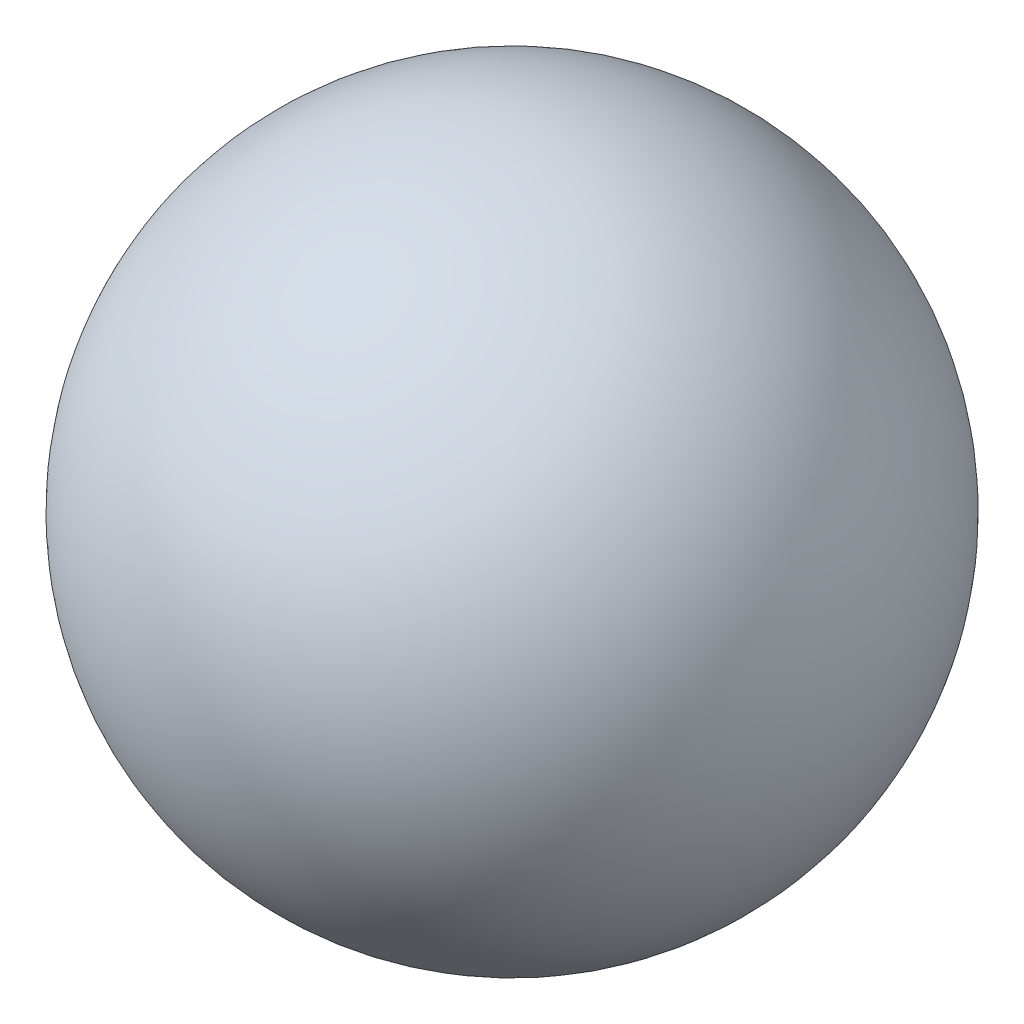
from build123d import *

# Parameters (mm, degrees)
VERRUNDUNG3_R              = 7.5
VERRUNDUNG5_R              = 3
VERRUNDUNG3_OF_SPIEGELN3_R = 7.5
VERRUNDUNG5_OF_SPIEGELN3_R = 3


# Read off the part's stored shape, not the designer's step: Spiegeln4, Spiegeln5
with BuildPart() as part:
    # Skizze1 → Rotation1 (revolve)
    with BuildSketch(Plane.XY):
        with BuildLine():
            Line((-25.5, 0), (-25, 0))
            ThreePointArc((-25, 0), (0, 25), (25, 0))
            Line((25, 0), (25.5, 0))
            ThreePointArc((25.5, 0), (0, 25.5), (-25.5, 0))
        make_face()
        with BuildLine():
            Line((-5, 0), (5, 0))
            ThreePointArc((5, 0), (0, 5), (-5, 0))
        make_face()
    revolve(axis=Axis((0, 0, 0), (-1, 0, 0)))

    # Skizze1<3> → Rotation3 (revolve)
    with BuildSketch(Plane.XY, mode=Mode.PRIVATE) as rotation3_sk:
        with BuildLine():
            Line((-25, 0), (-25, 2))
            add(Edge.make_bspline(
                [(-25, 2), (-15.943906555, -0.257937692), (-9.056093445, -0.257937692), (0, 2)],
                knots=[0, 0, 0, 0, 1, 1, 1, 1], degree=3))
            Line((0, 2), (0, 0))
            Line((0, 0), (-25, 0))
        make_face()
    rotation3 = revolve(rotation3_sk.sketch.rotate(Axis((0, 0, 0), (-1, 0, 0)), 180), axis=Axis((0, 0, 0), (-1, 0, 0)))

    # Verrundung3
    verrundung3_edges = [part.edges().sort_by_distance(p)[0] for p in [
        (-24.921432573, 0, -1.980454107),
    ]]
    fillet(verrundung3_edges, radius=VERRUNDUNG3_R)

    # Verrundung5
    verrundung5_edges = [part.edges().sort_by_distance(p)[0] for p in [
        (-4.905784294, 0, -0.966064423),
    ]]
    fillet(verrundung5_edges, radius=VERRUNDUNG5_R)

    # Spiegeln3: Rotation3 across plane
    add(rotation3.mirror(Plane(origin=(0, 0, 0), x_dir=(0, 0, 1), z_dir=(1, 0, 0))))

    # Verrundung3 of Spiegeln3
    verrundung3_of_spiegeln3_edges = [part.edges().sort_by_distance(p)[0] for p in [
        (24.921432573, 0, -1.980454107),
    ]]
    fillet(verrundung3_of_spiegeln3_edges, radius=VERRUNDUNG3_OF_SPIEGELN3_R)

    # Verrundung5 of Spiegeln3
    verrundung5_of_spiegeln3_edges = [part.edges().sort_by_distance(p)[0] for p in [
        (4.905784294, 0, -0.966064423),
    ]]
    fillet(verrundung5_of_spiegeln3_edges, radius=VERRUNDUNG5_OF_SPIEGELN3_R)

    # Spiegeln4: part across plane


with BuildPart() as part_1:
    add(part.part)
    add(part.part.mirror(Plane(origin=(0, 0, 0), x_dir=(0, 0, 1), z_dir=(0.7071067811865476, 0.7071067811865476, 0))))

    # Spiegeln5: part across plane


with BuildPart() as part_2:
    add(part_1.part)
    add(part_1.part.mirror(Plane(origin=(0, 0, 0), x_dir=(0.7071067811865478, 0, 0.7071067811865472), z_dir=(0.7071067811865475, 0, -0.7071067811865477))))


solid = part_2.part
